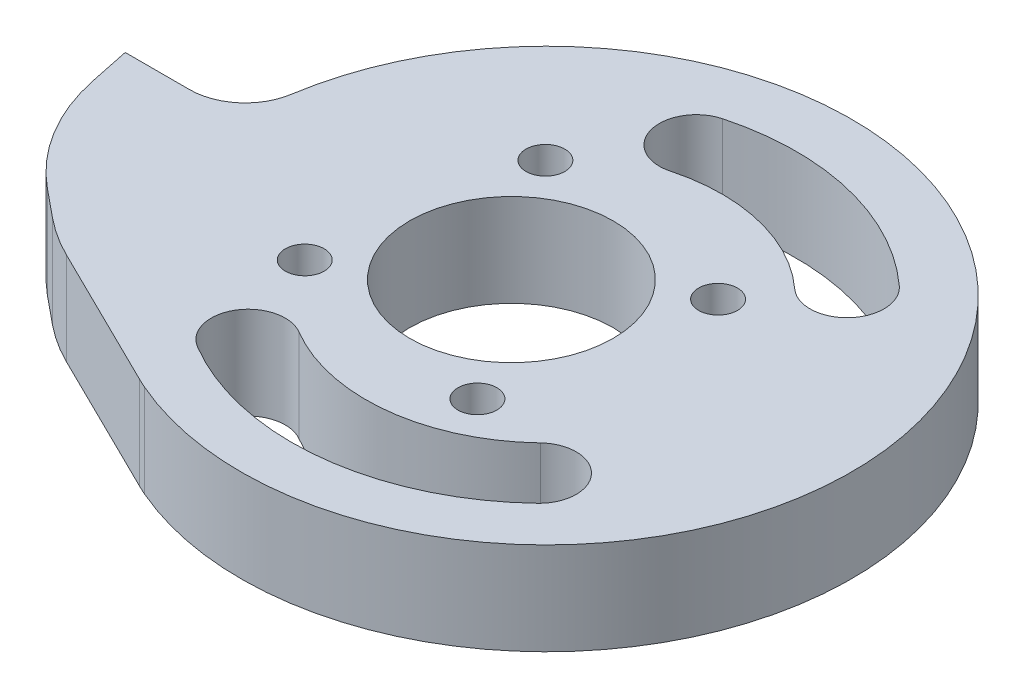
from build123d import *

# Parameters (mm, degrees)
SKETCH1_R           = 11
BOSS_EXTRUDE1_DEPTH = 10
SKETCH2_R           = 2.1
CUT_EXTRUDE1_DEPTH  = 58.089841478
CUT_EXTRUDE3_DEPTH  = 10
FILLET1_R           = 6
FILLET2_R           = 22


with BuildPart() as part:
    # Sketch1 → Boss-Extrude1 (new body)
    with BuildSketch(Plane(origin=(0, 0, 0), x_dir=(1, 0, 0), z_dir=(0, 1, 0))):
        with BuildLine():
            Line((-33, 0), (-45.5, 0))
            Line((-45.5, 0), (-43, -12))
            Line((-43, -12), (-32, -21))
            Line((-32, -21), (-13.747727085, -30))
            ThreePointArc((-13.747727085, -30), (27.772963416, 17.823089045), (-33, 0))
        make_face()
        with Locations(Location((-3.38, -0.39, 0), (0, 0, 270))):
            Circle(SKETCH1_R, mode=Mode.SUBTRACT)
    extrude(amount=BOSS_EXTRUDE1_DEPTH)

    # Sketch2 → Cut-Extrude1 (cut, through all)
    with BuildSketch(Plane(origin=(0, 10, 0), x_dir=(1, 0, 0), z_dir=(0, 1, 0))):
        with Locations(Location((9.62, 8.937379053, 0), (0, 0, 270))):
            Circle(SKETCH2_R)
        with Locations(Location((5.947379053, -13.39, 0), (0, 0, 270))):
            Circle(SKETCH2_R)
        with Locations(Location((-16.38, -9.717379053, 0), (0, 0, 270))):
            Circle(SKETCH2_R)
        with Locations(Location((-12.707379053, 12.61, 0), (0, 0, 270))):
            Circle(SKETCH2_R)
    extrude(amount=-CUT_EXTRUDE1_DEPTH, mode=Mode.SUBTRACT)

    # Sketch4 → Cut-Extrude3 (cut)
    with BuildSketch(Plane(origin=(0, 10, 0), x_dir=(1, 0, 0), z_dir=(0, 1, 0))):
        with BuildLine():
            ThreePointArc((-14.042553191, -23.644379879), (3.102926355, -27.324381933), (18.986679589, -19.893617021))
            ThreePointArc((18.986679589, -19.893617021), (19.118597761, -14.238301151), (13.46328189, -14.106382979))
            ThreePointArc((13.46328189, -14.106382979), (2.20025687, -19.375470825), (-9.957446809, -16.766014823))
            ThreePointArc((-9.957446809, -16.766014823), (-15.439182528, -18.16264416), (-14.042553191, -23.644379879))
        make_face()
        with BuildLine():
            ThreePointArc((18.186182669, 19.956521739), (6.35363251, 26.241786409), (-7.043478261, 26.065099539))
            ThreePointArc((-7.043478261, 26.065099539), (-9.861496228, 21.16012505), (-4.956521739, 18.342107083))
            ThreePointArc((-4.956521739, 18.342107083), (4.471074729, 18.466442288), (12.797684101, 14.043478261))
            ThreePointArc((12.797684101, 14.043478261), (18.448455124, 14.305750716), (18.186182669, 19.956521739))
        make_face()
    extrude(amount=-CUT_EXTRUDE3_DEPTH, mode=Mode.SUBTRACT)

    # Fillet1
    fillet1_edges = [part.edges().sort_by_distance(p)[0] for p in [
        (-33, 5, 0),
    ]]
    fillet(fillet1_edges, radius=FILLET1_R)

    # Fillet2
    # the kernel refuses this fillet: 22 mm, written as the material it takes off along each edge
    with BuildSketch(Plane(origin=(-13.747727085, -1.715684323, 30), x_dir=(0.913373582201966, 0, 0.4071224623323412), z_dir=(0, 1, 0))) as fillet2_piece_1:
        with BuildLine():
            CenterArc((0.45751582, 21.998810646), FILLET2_R, 267.776788076, 2.81898915)
            Line((-0.39592208, 0.015370429), (0, 0))
            ThreePointArc((0, 0), (0.343136865, -0.001784032), (0.686273729, 0))
        make_face()
    extrude(amount=13.431368647, mode=Mode.SUBTRACT)
    with BuildSketch(Plane(origin=(-32, -6.286877036, 21), x_dir=(-0.7739572992033206, 0, -0.6332377902572631), z_dir=(0, 1, 0))) as fillet2_piece_2:
        with BuildLine():
            CenterArc((FILLET2_R * 0.114306855208, -FILLET2_R), FILLET2_R, 90, 13.041994835)
            Line((-FILLET2_R * 0.111358301376, -FILLET2_R * 0.0257950743792), (0, 0))
            Line((0, 0), (FILLET2_R * 0.114306855208, 0))
        make_face()
    extrude(amount=22.573754073, mode=Mode.SUBTRACT)
    with BuildSketch(Plane(origin=(-43, -19.445362474, 12), x_dir=(-0.20395425411200122, 0, -0.978980419737605), z_dir=(0, 1, 0))) as fillet2_piece_3:
        with BuildLine():
            CenterArc((FILLET2_R * 0.353552044976, -FILLET2_R), FILLET2_R, 90, 38.942304205)
            Line((-FILLET2_R * 0.27498545547, -FILLET2_R * 0.222220718627), (0, 0))
            Line((0, 0), (FILLET2_R * 0.353552044976, 0))
        make_face()
    extrude(amount=48.890724947, mode=Mode.SUBTRACT)


solid = part.part
